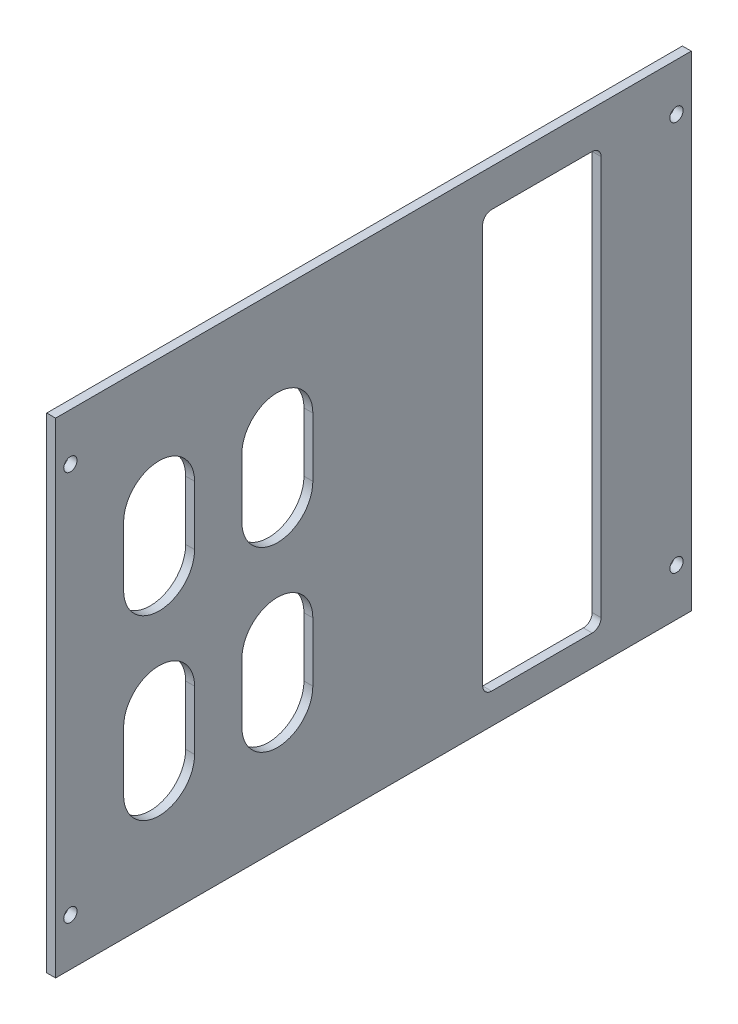
from build123d import *

# Parameters (mm, degrees)
SKETCH_1_W                         = 240
SKETCH_1_H                         = 170
EXTRUDE_1_DEPTH                    = 3
EXTRUDE_2_DEPTH                    = 10
EXTRUDE_3_DEPTH                    = 10
SKETCH_4_R                         = 3
CUT_EXTRUDE_1_DEPTH                = 6
SKETCH_5_R                         = 2.1
CUT_EXTRUDE_2_DEPTH                = 253.117036314
SKETCH_7_R                         = 1.6
SKETCH_7_W                         = 103
SKETCH_7_H                         = 20
EXTRUDE_4_DEPTH                    = 3
SKETCH_8_W                         = 110
SKETCH_8_H                         = 164
SKETCH_8_R                         = 2.1
EXTRUDE_5_DEPTH                    = 3
SKETCH_9_W                         = 240
SKETCH_9_H                         = 110
EXTRUDE_6_DEPTH                    = 3
SKETCH_10_R                        = 1.6
EXTRUDE_7_DEPTH                    = 2
SKETCH_11_W                        = 10
SKETCH_11_H                        = 20.7
SKETCH_11_R                        = 3
EXTRUDE_8_DEPTH                    = 6
CUT_EXTRUDE_3_DEPTH                = 237.788935552
SKETCH_14_R                        = 5
SKETCH_14_R_2                      = 2.25
EXTRUDE_9_DEPTH                    = 5
SKETCH_16_W                        = 20
SKETCH_16_H                        = 150
EXTRUDE_13_DEPTH                   = 3
CUT_EXTRUDE_5_DEPTH                = 282.346761133
EXTRUDE_START                      = 100
EXTRUDE_14_DEPTH                   = 10
SKETCH_21_R                        = 1.65
CUT_EXTRUDE_6_DEPTH                = 242.828451593
SKETCH_22_R                        = 3
CUT_EXTRUDE_7_DEPTH                = 240.666434863
FILLET_1_R                         = 3
FILLET_2_R                         = 3
SKETCH_4_5_R                       = 2.25
F_4_5_3MM_DEPTH                    = 3.01
SKETCH_Y_6_R                       = 3
CUT_EXTRUDE_Y_6_DEPTH              = 6.01
SKETCH_Y_3_2_R                     = 1.6
CUT_EXTRUDE_Y_3_2_DEPTH            = 3.01
A_M4_2_R                           = 2.25
A_M4_DEPTH                         = 9.01
B_M4_2_R                           = 2.25
B_M4_DEPTH                         = 9.01
MOVE_FACE_M4_4_2_4_5_BY            = 0.15
MOVE_FACE_M4_4_2_4_5_2_BY          = 0.15
MOVE_FACE_M4_4_2_4_5_3_BY          = 0.15
MOVE_FACE_M4_4_2_4_5_4_BY          = 0.15
MOVE_FACE_M4_4_2_4_5_5_BY          = 0.15
MOVE_FACE_M4_4_2_4_5_6_BY          = 0.15
MOVE_FACE_M4_4_2_4_5_7_BY          = 0.15
MOVE_FACE_M4_4_2_4_5_8_BY          = 0.15
MOVE_FACE_M4_6_4_5_BY              = 0.75
MOVE_FACE_M4_6_4_5_2_BY            = 0.75
MOVE_FACE_M4_6_4_5_3_BY            = 0.75
MOVE_FACE_M4_6_4_5_4_BY            = 0.75
MOVE_START                         = -85
MOVE_FACE_M4_3_2_4_5_OUTLINE_R     = 2.25
MOVE_FACE_M4_3_2_4_5_OUTLINE_R_2   = 1.6
MOVE_FACE_M4_3_2_4_5_DEPTH         = 3
MOVE_START_2                       = 82
MOVE_FACE_M4_3_2_4_5_2_OUTLINE_R   = 2.25
MOVE_FACE_M4_3_2_4_5_2_OUTLINE_R_2 = 1.6
MOVE_FACE_M4_3_2_4_5_2_DEPTH       = 3
MOVE_START_3                       = 47
MOVE_FACE_6_M3_3_3_OUTLINE_R       = 3
MOVE_FACE_6_M3_3_3_OUTLINE_R_2     = 1.65
MOVE_FACE_6_M3_3_3_DEPTH           = 6
MOVE_FACE_6_M3_3_3_2_OUTLINE_R     = 3
MOVE_FACE_6_M3_3_3_2_OUTLINE_R_2   = 1.65
MOVE_FACE_6_M3_3_3_2_DEPTH         = 6
MOVE_START_4                       = -82
MOVE_FACE_6_M3_3_3_3_OUTLINE_R     = 3
MOVE_FACE_6_M3_3_3_3_OUTLINE_R_2   = 1.65
MOVE_FACE_6_M3_3_3_3_DEPTH         = 6
MOVE_START_5                       = 76
MOVE_FACE_6_M3_3_3_4_OUTLINE_R     = 3
MOVE_FACE_6_M3_3_3_4_OUTLINE_R_2   = 1.65
MOVE_FACE_6_M3_3_3_4_DEPTH         = 6
Y_M3_5_9_1_5_DEPTH                 = 1.5
Y_M3_5_9_1_5_3_DEPTH               = 1.5
V3_03_A_105_START                  = 117
V3_03_A_105_OUTLINE_W              = 164
V3_03_A_105_OUTLINE_H              = 105
V3_03_A_105_OUTLINE_R              = 2.25
V3_03_A_105_DEPTH                  = 3
V3_04_B_105_START                  = -120
V3_04_B_105_OUTLINE_W              = 164
V3_04_B_105_OUTLINE_H              = 105
V3_04_B_105_OUTLINE_R              = 2.25
V3_04_B_105_DEPTH                  = 3
V3_06_B_105_START                  = 82
V3_06_B_105_OUTLINE_W              = 240
V3_06_B_105_OUTLINE_H              = 105
V3_06_B_105_OUTLINE_R              = 2.25
V3_06_B_105_DEPTH                  = 3
V3_05_A_105_START                  = -85
V3_05_A_105_OUTLINE_R              = 2.25
V3_05_A_105_DEPTH                  = 3
V3_77X53_2_W                       = 77
V3_77X53_2_H                       = 53
V3_77X53_DEPTH                     = 3.01
CUT_EXTRUDE_8_DEPTH                = 140.649561403


# Read off the part's stored shape, not the designer's step: 侧板下部四处M4_四个Ø3.2配对孔改Ø4.5通孔, 取消剩余八处铜嵌件_Ø6座改M3Ø3.3通孔, v3_03_端板A_下沿及底部孔下移105, v3_04_端板B_下沿及底部孔下移105, v3_06_侧板B_下沿及底部孔下移105, v3_05_侧板A_下沿及底部孔下移105
with BuildPart() as part:
    # 草图1 → 凸台-拉伸1 (new body)
    with BuildSketch(Plane.XY):
        Rectangle(SKETCH_1_W, SKETCH_1_H)
    extrude(amount=EXTRUDE_1_DEPTH)

    # 草图2 → 凸台-拉伸2 (add)
    with BuildSketch(Plane.XY.offset(3)):
        Polygon((117, -82), (117, -61), (111, -61), (111, -76), (96, -76), (96, -82), align=None)
        Polygon((96, 82), (117, 82), (117, 61), (111, 61), (111, 76), (96, 76), align=None)
        Polygon((-96, -82), (-117, -82), (-117, -61), (-111, -61), (-111, -76), (-96, -76), align=None)
        Polygon((-117, 82), (-117, 61), (-111, 61), (-111, 76), (-96, 76), (-96, 82), align=None)
    extrude(amount=EXTRUDE_2_DEPTH)

    # 草图3 → 凸台-拉伸3 (add)
    with BuildSketch(Plane.XY.offset(3)):
        Polygon((-22, 35), (-7, 35), (-7, 41), (-28, 41), (-43, 41), (-43, 35), (-28, 35), (-28, 20), (-22, 20), align=None)
        Polygon((117, 20), (111, 20), (111, 35), (96, 35), (96, 41), (117, 41), align=None)
        Polygon((-28, -35), (-28, -20), (-22, -20), (-22, -41), (-43, -41), (-43, -35), align=None)
        Polygon((-83, -41), (-83, -35), (-98, -35), (-98, -20), (-104, -20), (-104, -41), align=None)
        Polygon((-104, 20), (-104, 35), (-104, 41), (-98, 41), (-83, 41), (-83, 35), (-98, 35), (-98, 20), align=None)
    extrude(amount=EXTRUDE_3_DEPTH)

    # 草图4 → 切除-拉伸1 (cut)
    with BuildSketch(Plane.XZ.offset(82)):
        with Locations((101, 8)):
            Circle(SKETCH_4_R)
        with Locations((-101, 8)):
            Circle(SKETCH_4_R)
    extrude(amount=-CUT_EXTRUDE_1_DEPTH, mode=Mode.SUBTRACT)

    # 草图5 → 切除-拉伸2 (cut, through all)
    with BuildSketch(Plane.ZY.offset(117)):
        with Locations(Location((8, -66, 0), (0, 0, 270))):
            Circle(SKETCH_5_R)
        with Locations(Location((8, 66, 0), (0, 0, 270))):
            Circle(SKETCH_5_R)
    extrude(amount=-CUT_EXTRUDE_2_DEPTH, mode=Mode.SUBTRACT)

    # 底部正Y卡件_补齐两处Ø6铜螺母安装孔_固定孔位草图 → 底部正Y卡件_补齐两处Ø6铜螺母安装孔 (cut)
    with BuildSketch(Plane.XZ.offset(-76)):
        with Locations((-101, 8)):
            Circle(SKETCH_Y_6_R)
        with Locations((101, 8)):
            Circle(SKETCH_Y_6_R)
    extrude(amount=-CUT_EXTRUDE_Y_6_DEPTH, mode=Mode.SUBTRACT)

    # Move Face M4__4.2_4.5 3: a curved face moved inward by 0.15
    add(Solid.thicken(part.faces().sort_by_distance((-114, -63.9, 8))[0], -MOVE_FACE_M4_4_2_4_5_3_BY), mode=Mode.SUBTRACT)

    # Move Face M4__4.2_4.5 4: a curved face moved inward by 0.15
    add(Solid.thicken(part.faces().sort_by_distance((-114, 68.1, 8))[0], -MOVE_FACE_M4_4_2_4_5_4_BY), mode=Mode.SUBTRACT)

    # Move Face M4__4.2_4.5 5: a curved face moved inward by 0.15
    add(Solid.thicken(part.faces().sort_by_distance((114, 68.1, 8))[0], -MOVE_FACE_M4_4_2_4_5_5_BY), mode=Mode.SUBTRACT)

    # Move Face M4__4.2_4.5 6: a curved face moved inward by 0.15
    add(Solid.thicken(part.faces().sort_by_distance((114, -63.9, 8))[0], -MOVE_FACE_M4_4_2_4_5_6_BY), mode=Mode.SUBTRACT)

    # Move Face M4__6_4.5: a curved face moved outward by 0.75
    add(Solid.thicken(part.faces().sort_by_distance((-104, -79, 8))[0], MOVE_FACE_M4_6_4_5_BY))

    # Move Face M4__6_4.5 2: a curved face moved outward by 0.75
    add(Solid.thicken(part.faces().sort_by_distance((98, -79, 8))[0], MOVE_FACE_M4_6_4_5_2_BY))

    # Move Face M4__6_4.5 3: a curved face moved outward by 0.75
    add(Solid.thicken(part.faces().sort_by_distance((-104, 79, 8))[0], MOVE_FACE_M4_6_4_5_3_BY))

    # Move Face M4__6_4.5 4: a curved face moved outward by 0.75
    add(Solid.thicken(part.faces().sort_by_distance((98, 79, 8))[0], MOVE_FACE_M4_6_4_5_4_BY))


with BuildPart() as body_2:
    # 草图7 → 凸台-拉伸4 (new body)
    with BuildSketch(Plane.XZ.offset(85)):
        Polygon((-120, 3), (-83, 3), (-83, 13), (-43, 13), (-43, 3), (120, 3), (120, 113), (-120, 113), align=None)
        with Locations(Location((101, 8, 0), (0, 0, 270))):
            Circle(SKETCH_7_R, mode=Mode.SUBTRACT)
        with Locations(Location((-101, 8, 0), (0, 0, 270))):
            Circle(SKETCH_7_R, mode=Mode.SUBTRACT)
        with Locations((44.5, 23)):
            Rectangle(SKETCH_7_W, SKETCH_7_H, mode=Mode.SUBTRACT)
    extrude(amount=-EXTRUDE_4_DEPTH)


with BuildPart() as body_3:
    # 草图8 → 凸台-拉伸5 (new body)
    with BuildSketch(Plane(origin=(117, 0, 0), x_dir=(0, 0, -1), z_dir=(1, 0, 0))):
        with Locations((-58, 0)):
            Rectangle(SKETCH_8_W, SKETCH_8_H)
        with Locations(Location((-8, -66, 0), (0, 0, 90))):
            Circle(SKETCH_8_R, mode=Mode.SUBTRACT)
        with Locations(Location((-8, 66, 0), (0, 0, 90))):
            Circle(SKETCH_8_R, mode=Mode.SUBTRACT)
    extrude(amount=EXTRUDE_5_DEPTH)


with BuildPart() as body_4:
    # 镜向1: mirrored copy
    add(body_3.part.mirror(Plane(origin=(0, 0, 0), x_dir=(0, 0, 1), z_dir=(1, 0, 0))))


with BuildPart() as body_5:
    # 草图9 → 凸台-拉伸6 (new body)
    with BuildSketch(Plane(origin=(0, 82, 0), x_dir=(1, 0, 0), z_dir=(0, 1, 0))):
        with Locations((0, -58)):
            Rectangle(SKETCH_9_W, SKETCH_9_H)
    extrude(amount=EXTRUDE_6_DEPTH)


    add(body_2.part)  # 凸台-拉伸8 merges body 2
    # 草图11 → 凸台-拉伸8 (add)
    # profile 1 of 4: a face of its own
    with BuildSketch(Plane(origin=(0, 0, 53), x_dir=(-1, 0, 0), z_dir=(0, 0, -1))):
        with Locations((-112, 71.65)):
            Rectangle(SKETCH_11_W, SKETCH_11_H)
        with Locations((-112, 66.3)):
            Circle(SKETCH_11_R, mode=Mode.SUBTRACT)
    # profile 2 of 4: a face of its own
    with BuildSketch(Plane(origin=(0, 0, 53), x_dir=(-1, 0, 0), z_dir=(0, 0, -1))):
        with Locations((-112, -71.65)):
            Rectangle(SKETCH_11_W, SKETCH_11_H)
        with Locations((-112, -66.3)):
            Circle(SKETCH_11_R, mode=Mode.SUBTRACT)
    # profile 3 of 4: a face of its own
    with BuildSketch(Plane(origin=(0, 0, 53), x_dir=(-1, 0, 0), z_dir=(0, 0, -1))):
        with Locations((-26, -71.65)):
            Rectangle(SKETCH_11_W, SKETCH_11_H)
        with Locations((-26, -66.3)):
            Circle(SKETCH_11_R, mode=Mode.SUBTRACT)
    # profile 4 of 4: a face of its own
    with BuildSketch(Plane(origin=(0, 0, 53), x_dir=(-1, 0, 0), z_dir=(0, 0, -1))):
        with Locations((-26, 71.65)):
            Rectangle(SKETCH_11_W, SKETCH_11_H)
        with Locations((-26, 66.3)):
            Circle(SKETCH_11_R, mode=Mode.SUBTRACT)
    extrude(amount=EXTRUDE_8_DEPTH)

    # 草图12 → 切除-拉伸3 (cut, through all)
    with BuildSketch(Plane.XZ.offset(85)):
        with BuildLine():
            Line((109, 56), (5, 56))
            ThreePointArc((5, 56), (2.878679656, 56.878679656), (2, 59))
            Line((2, 59), (2, 73))
            ThreePointArc((2, 73), (2.878679656, 75.121320344), (5, 76))
            Line((5, 76), (109, 76))
            ThreePointArc((109, 76), (111.121320344, 75.121320344), (112, 73))
            Line((112, 73), (112, 59))
            ThreePointArc((112, 59), (111.121320344, 56.878679656), (109, 56))
        make_face()
    extrude(amount=-CUT_EXTRUDE_3_DEPTH, mode=Mode.SUBTRACT)

    # 草图14 → 凸台-拉伸9 (add)
    # profile 1 of 4: a face of its own
    with BuildSketch(Plane(origin=(0, 85, 0), x_dir=(1, 0, 0), z_dir=(0, 1, 0))):
        with Locations(Location((-109.209330844, -20.536345828, 0), (0, 0, 180))):
            Circle(SKETCH_14_R)
        with Locations(Location((-109.209330844, -20.536345828, 0), (0, 0, 180))):
            Circle(SKETCH_14_R_2, mode=Mode.SUBTRACT)
    # profile 2 of 4: a face of its own
    with BuildSketch(Plane(origin=(0, 85, 0), x_dir=(1, 0, 0), z_dir=(0, 1, 0))):
        with Locations(Location((-34.159330844, -20.536345828, 0), (0, 0, 180))):
            Circle(SKETCH_14_R)
        with Locations(Location((-34.159330844, -20.536345828, 0), (0, 0, 180))):
            Circle(SKETCH_14_R_2, mode=Mode.SUBTRACT)
    # profile 3 of 4: a face of its own
    with BuildSketch(Plane(origin=(0, 85, 0), x_dir=(1, 0, 0), z_dir=(0, 1, 0))):
        with Locations(Location((-34.159330844, -95.586345828, 0), (0, 0, 180))):
            Circle(SKETCH_14_R)
        with Locations(Location((-34.159330844, -95.586345828, 0), (0, 0, 180))):
            Circle(SKETCH_14_R_2, mode=Mode.SUBTRACT)
    # profile 4 of 4: a face of its own
    with BuildSketch(Plane(origin=(0, 85, 0), x_dir=(1, 0, 0), z_dir=(0, 1, 0))):
        with Locations(Location((-109.209330844, -95.586345828, 0), (0, 0, 180))):
            Circle(SKETCH_14_R)
        with Locations(Location((-109.209330844, -95.586345828, 0), (0, 0, 180))):
            Circle(SKETCH_14_R_2, mode=Mode.SUBTRACT)
    extrude(amount=EXTRUDE_9_DEPTH)


with BuildPart() as body_6:
    # 草图10 → 凸台-拉伸7 (new body)
    with BuildSketch(Plane.XY.offset(53)):
        Polygon((117, 82), (105.994732546, 82), (105.994732546, 66.3), (31.393483554, 66.3), (31.393483554, 82), (21, 82), (21, -82), (117, -82), align=None)
        with Locations((26, 66.3)):
            Circle(SKETCH_10_R, mode=Mode.SUBTRACT)
        with Locations((112, 66.3)):
            Circle(SKETCH_10_R, mode=Mode.SUBTRACT)
        with Locations((112, -66.3)):
            Circle(SKETCH_10_R, mode=Mode.SUBTRACT)
        with Locations((26, -66.3)):
            Circle(SKETCH_10_R, mode=Mode.SUBTRACT)
    extrude(amount=EXTRUDE_7_DEPTH)


with BuildPart() as body_6_2:
    # 草图16 → 凸台-拉伸13 (new body)
    with BuildSketch(Plane.XY.offset(113)):
        Polygon((-120, 85), (120, 85), (120, -85), (-120, -85), (-120, -15), (-112, -15), (-112, 15), (-120, 15), align=None)
        with Locations((21, 0)):
            Rectangle(SKETCH_16_W, SKETCH_16_H, mode=Mode.SUBTRACT)
    extrude(amount=EXTRUDE_13_DEPTH)

    # 草图20 → 凸台-拉伸14 (add)
    with BuildSketch(Plane.XY.offset(13).offset(EXTRUDE_START)):
        Polygon((111, 61), (111, 76), (96, 76), (96, 82), (117, 82), (117, 61), align=None)
        Polygon((-96, 82), (-117, 82), (-117, 61), (-111, 61), (-111, 76), (-96, 76), align=None)
        Polygon((-117, -61), (-117, -82), (-96, -82), (-96, -76), (-111, -76), (-111, -61), align=None)
        Polygon((111, -76), (96, -76), (96, -82), (117, -82), (117, -61), (111, -61), align=None)
    extrude(amount=-EXTRUDE_14_DEPTH)


with BuildPart() as cut_extrude_5_tool:
    # 草图18 → 切除-拉伸5 (new, through all)
    with BuildSketch(Plane(origin=(120, 0, 0), x_dir=(0, 0, -1), z_dir=(1, 0, 0))):
        with BuildLine():
            Line((-66, 40), (-66, 20))
            ThreePointArc((-66, 20), (-78, 8), (-90, 20))
            Line((-90, 20), (-90, 40))
            ThreePointArc((-90, 40), (-78, 52), (-66, 40))
        make_face()
        with BuildLine():
            Line((-66, -40), (-66, -20))
            ThreePointArc((-66, -20), (-78, -8), (-90, -20))
            Line((-90, -20), (-90, -40))
            ThreePointArc((-90, -40), (-78, -52), (-66, -40))
        make_face()
        with BuildLine():
            Line((-50, -40), (-50, -20))
            ThreePointArc((-50, -20), (-38, -8), (-26, -20))
            Line((-26, -20), (-26, -40))
            ThreePointArc((-26, -40), (-38, -52), (-50, -40))
        make_face()
        with BuildLine():
            Line((-50, 40), (-50, 20))
            ThreePointArc((-50, 20), (-38, 8), (-26, 20))
            Line((-26, 20), (-26, 40))
            ThreePointArc((-26, 40), (-38, 52), (-50, 40))
        make_face()
    extrude(amount=-CUT_EXTRUDE_5_DEPTH)


with BuildPart() as body_3_1:
    add(body_3.part)

    # 切除-拉伸5: cut by cut_extrude_5_tool
    add(cut_extrude_5_tool.part, mode=Mode.SUBTRACT)


with BuildPart() as body_4_1:
    add(body_4.part)

    # 切除-拉伸5: cut by cut_extrude_5_tool
    add(cut_extrude_5_tool.part, mode=Mode.SUBTRACT)


with BuildPart() as cut_extrude_6_tool:
    # 草图21 → 切除-拉伸6 (new, through all)
    with BuildSketch(Plane.XZ.offset(85)):
        with Locations(Location((101, 108, 0), (0, 0, 180))):
            Circle(SKETCH_21_R)
        with Locations(Location((-101, 108, 0), (0, 0, 180))):
            Circle(SKETCH_21_R)
    extrude(amount=-CUT_EXTRUDE_6_DEPTH)


with BuildPart() as body_5_1:
    add(body_5.part)

    # 切除-拉伸6: cut by cut_extrude_6_tool
    add(cut_extrude_6_tool.part, mode=Mode.SUBTRACT)

    # 圆角1
    fillet_1_edges = [body_5_1.edges().sort_by_distance(p)[0] for p in [
        (-43, -83.5, 13),
        (-83, -83.5, 13),
        (96, -83.5, 13),
        (-7, -83.5, 13),
        (-7, -83.5, 33),
        (96, -83.5, 33),
    ]]
    fillet(fillet_1_edges, radius=FILLET_1_R)

    # 四处Ø4.5通孔_孔位与孔径固定 → 四处Ø4.5盲孔_贯穿剩余3mm底壁 (cut)
    with BuildSketch(Plane.XZ.offset(-82)):
        with Locations((-109.209330844, 20.536345828)):
            Circle(SKETCH_4_5_R)
        with Locations((-34.159330844, 20.536345828)):
            Circle(SKETCH_4_5_R)
        with Locations((-34.159330844, 95.586345828)):
            Circle(SKETCH_4_5_R)
        with Locations((-109.209330844, 95.586345828)):
            Circle(SKETCH_4_5_R)
    extrude(amount=-F_4_5_3MM_DEPTH, mode=Mode.SUBTRACT)

    # 正Y侧板底部_补齐两处Ø3.2螺丝通孔_固定孔位草图 → 正Y侧板底部_补齐两处Ø3.2螺丝通孔 (cut)
    with BuildSketch(Plane.XZ.offset(-82)):
        with Locations((-101, 8)):
            Circle(SKETCH_Y_3_2_R)
        with Locations((101, 8)):
            Circle(SKETCH_Y_3_2_R)
    extrude(amount=-CUT_EXTRUDE_Y_3_2_DEPTH, mode=Mode.SUBTRACT)

    # Move Face M4__3.2_4.5 outline → Move Face M4__3.2_4.5 (cut)
    # profile 1 of 2: a face of its own
    with BuildSketch(Plane(origin=(0, 0, 0), x_dir=(1, 0, 0), z_dir=(0, 1, 0)).offset(MOVE_START)):
        with Locations((101, -8)):
            Circle(MOVE_FACE_M4_3_2_4_5_OUTLINE_R)
        with Locations((101, -8)):
            Circle(MOVE_FACE_M4_3_2_4_5_OUTLINE_R_2, mode=Mode.SUBTRACT)
    # profile 2 of 2: a face of its own
    with BuildSketch(Plane(origin=(0, 0, 0), x_dir=(1, 0, 0), z_dir=(0, 1, 0)).offset(MOVE_START)):
        with Locations((-101, -8)):
            Circle(MOVE_FACE_M4_3_2_4_5_OUTLINE_R)
        with Locations((-101, -8)):
            Circle(MOVE_FACE_M4_3_2_4_5_OUTLINE_R_2, mode=Mode.SUBTRACT)
    extrude(amount=MOVE_FACE_M4_3_2_4_5_DEPTH, mode=Mode.SUBTRACT)

    # Move Face M4__3.2_4.5 2 outline → Move Face M4__3.2_4.5 2 (cut)
    # profile 1 of 2: a face of its own
    with BuildSketch(Plane(origin=(0, 0, 0), x_dir=(1, 0, 0), z_dir=(0, 1, 0)).offset(MOVE_START_2)):
        with Locations((101, -8)):
            Circle(MOVE_FACE_M4_3_2_4_5_2_OUTLINE_R)
        with Locations((101, -8)):
            Circle(MOVE_FACE_M4_3_2_4_5_2_OUTLINE_R_2, mode=Mode.SUBTRACT)
    # profile 2 of 2: a face of its own
    with BuildSketch(Plane(origin=(0, 0, 0), x_dir=(1, 0, 0), z_dir=(0, 1, 0)).offset(MOVE_START_2)):
        with Locations((-101, -8)):
            Circle(MOVE_FACE_M4_3_2_4_5_2_OUTLINE_R)
        with Locations((-101, -8)):
            Circle(MOVE_FACE_M4_3_2_4_5_2_OUTLINE_R_2, mode=Mode.SUBTRACT)
    extrude(amount=MOVE_FACE_M4_3_2_4_5_2_DEPTH, mode=Mode.SUBTRACT)

    # Move Face 6_M3_3.3 outline → Move Face 6_M3_3.3 (add)
    # profile 1 of 2: a face of its own
    with BuildSketch(Plane.XY.offset(MOVE_START_3)):
        with Locations((112, 66.3)):
            Circle(MOVE_FACE_6_M3_3_3_OUTLINE_R)
        with Locations((112, 66.3)):
            Circle(MOVE_FACE_6_M3_3_3_OUTLINE_R_2, mode=Mode.SUBTRACT)
    # profile 2 of 2: a face of its own
    with BuildSketch(Plane.XY.offset(MOVE_START_3)):
        with Locations((26, 66.3)):
            Circle(MOVE_FACE_6_M3_3_3_OUTLINE_R)
        with Locations((26, 66.3)):
            Circle(MOVE_FACE_6_M3_3_3_OUTLINE_R_2, mode=Mode.SUBTRACT)
    extrude(amount=MOVE_FACE_6_M3_3_3_DEPTH)

    # Move Face 6_M3_3.3 2 outline → Move Face 6_M3_3.3 2 (add)
    # profile 1 of 2: a face of its own
    with BuildSketch(Plane.XY.offset(MOVE_START_3)):
        with Locations((112, -66.3)):
            Circle(MOVE_FACE_6_M3_3_3_2_OUTLINE_R)
        with Locations((112, -66.3)):
            Circle(MOVE_FACE_6_M3_3_3_2_OUTLINE_R_2, mode=Mode.SUBTRACT)
    # profile 2 of 2: a face of its own
    with BuildSketch(Plane.XY.offset(MOVE_START_3)):
        with Locations((26, -66.3)):
            Circle(MOVE_FACE_6_M3_3_3_2_OUTLINE_R)
        with Locations((26, -66.3)):
            Circle(MOVE_FACE_6_M3_3_3_2_OUTLINE_R_2, mode=Mode.SUBTRACT)
    extrude(amount=MOVE_FACE_6_M3_3_3_2_DEPTH)

    # v3_06_侧板B_下沿及底部孔下移105 outline → v3_06_侧板B_下沿及底部孔下移105 (add)
    # profile 1 of 3: a face of its own
    with BuildSketch(Plane(origin=(0, 0, 0), x_dir=(1, 0, 0), z_dir=(0, 1, 0)).offset(V3_06_B_105_START)):
        with Locations((0, 49.5)):
            Rectangle(V3_06_B_105_OUTLINE_W, V3_06_B_105_OUTLINE_H)
        with Locations((-101, 97)):
            Circle(V3_06_B_105_OUTLINE_R, mode=Mode.SUBTRACT)
        with Locations((101, 97)):
            Circle(V3_06_B_105_OUTLINE_R, mode=Mode.SUBTRACT)
    # profile 2 of 3: a face of its own
    with BuildSketch(Plane(origin=(0, 0, 0), x_dir=(1, 0, 0), z_dir=(0, 1, 0)).offset(V3_06_B_105_START)):
        with Locations((101, -8)):
            Circle(V3_06_B_105_OUTLINE_R)
    # profile 3 of 3: a face of its own
    with BuildSketch(Plane(origin=(0, 0, 0), x_dir=(1, 0, 0), z_dir=(0, 1, 0)).offset(V3_06_B_105_START)):
        with Locations((-101, -8)):
            Circle(V3_06_B_105_OUTLINE_R)
    extrude(amount=V3_06_B_105_DEPTH)

    # v3_05_侧板A_下沿及底部孔下移105 outline → v3_05_侧板A_下沿及底部孔下移105 (add)
    # profile 1 of 3: a face of its own
    with BuildSketch(Plane(origin=(0, 0, 0), x_dir=(1, 0, 0), z_dir=(0, 1, 0)).offset(V3_05_A_105_START)):
        with BuildLine():
            Line((-43, -3), (120, -3))
            Line((120, -3), (120, 102))
            Line((120, 102), (-43, 102))
            Line((-43, 102), (-43, 95))
            ThreePointArc((-43, 95), (-43.878679656, 92.878679656), (-46, 92))
            Line((-46, 92), (-80, 92))
            ThreePointArc((-80, 92), (-82.121320344, 92.878679656), (-83, 95))
            Line((-83, 95), (-83, 102))
            Line((-83, 102), (-120, 102))
            Line((-120, 102), (-120, -3))
            Line((-120, -3), (-83, -3))
            Line((-83, -3), (-83, -10))
            ThreePointArc((-83, -10), (-82.121320344, -12.121320344), (-80, -13))
            Line((-80, -13), (-46, -13))
            ThreePointArc((-46, -13), (-43.878679656, -12.121320344), (-43, -10))
            Line((-43, -10), (-43, -3))
        make_face()
        with Locations((-101, 97)):
            Circle(V3_05_A_105_OUTLINE_R, mode=Mode.SUBTRACT)
        with Locations((101, 97)):
            Circle(V3_05_A_105_OUTLINE_R, mode=Mode.SUBTRACT)
    # profile 2 of 3: a face of its own
    with BuildSketch(Plane(origin=(0, 0, 0), x_dir=(1, 0, 0), z_dir=(0, 1, 0)).offset(V3_05_A_105_START)):
        with Locations((101, -8)):
            Circle(V3_05_A_105_OUTLINE_R)
    # profile 3 of 3: a face of its own
    with BuildSketch(Plane(origin=(0, 0, 0), x_dir=(1, 0, 0), z_dir=(0, 1, 0)).offset(V3_05_A_105_START)):
        with Locations((-101, -8)):
            Circle(V3_05_A_105_OUTLINE_R)
    extrude(amount=V3_05_A_105_DEPTH)

    # v3__77x53 2 → v3__77x53 (cut)
    with BuildSketch(Plane(origin=(0, 85, 0), x_dir=(1, 0, 0), z_dir=(0, 1, 0))):
        with Locations((69, 58.5)):
            Rectangle(V3_77X53_2_W, V3_77X53_2_H)
    extrude(amount=-V3_77X53_DEPTH, mode=Mode.SUBTRACT)


with BuildPart() as body_6_2_1:
    add(body_6_2.part)

    # 切除-拉伸6: cut by cut_extrude_6_tool
    add(cut_extrude_6_tool.part, mode=Mode.SUBTRACT)

    # 草图22 → 切除-拉伸7 (cut, through all)
    with BuildSketch(Plane.XZ.offset(82)):
        with Locations((-101, 108)):
            Circle(SKETCH_22_R)
        with Locations(Location((101, 108, 0), (0, 0, 270))):
            Circle(SKETCH_22_R)
    extrude(amount=-CUT_EXTRUDE_7_DEPTH, mode=Mode.SUBTRACT)

    # 圆角2
    fillet_2_edges = [body_6_2_1.edges().sort_by_distance(p)[0] for p in [
        (-112, -15, 114.5),
        (-112, 15, 114.5),
        (31, -75, 114.5),
        (31, 75, 114.5),
        (11, 75, 114.5),
        (11, -75, 114.5),
    ]]
    fillet(fillet_2_edges, radius=FILLET_2_R)


with BuildPart() as a_m4_tool:
    # A___M4 2 → A___M4 (new body)
    with BuildSketch(Plane.ZY.offset(-111)):
        with Locations(Location((108, -66, 0), (0, 0, 270))):
            Circle(A_M4_2_R)
        with Locations(Location((108, 66, 0), (0, 0, 270))):
            Circle(A_M4_2_R)
    extrude(amount=-A_M4_DEPTH)


with BuildPart() as body_3_2:
    add(body_3_1.part)

    # A___M4: cut by a_m4_tool
    add(a_m4_tool.part, mode=Mode.SUBTRACT)

    # Move Face M4__4.2_4.5: a curved face moved inward by 0.15
    add(Solid.thicken(body_3_2.faces().sort_by_distance((118.5, -68.1, 8))[0], -MOVE_FACE_M4_4_2_4_5_BY), mode=Mode.SUBTRACT)

    # Move Face M4__4.2_4.5 2: a curved face moved inward by 0.15
    add(Solid.thicken(body_3_2.faces().sort_by_distance((118.5, 63.9, 8))[0], -MOVE_FACE_M4_4_2_4_5_2_BY), mode=Mode.SUBTRACT)

    # v3_03_端板A_下沿及底部孔下移105 outline → v3_03_端板A_下沿及底部孔下移105 (add)
    # profile 1 of 3: a face of its own
    with BuildSketch(Plane.YZ.offset(V3_03_A_105_START)):
        with Locations((0, -49.5)):
            Rectangle(V3_03_A_105_OUTLINE_W, V3_03_A_105_OUTLINE_H)
        with Locations((-66, -97)):
            Circle(V3_03_A_105_OUTLINE_R, mode=Mode.SUBTRACT)
        with Locations((66, -97)):
            Circle(V3_03_A_105_OUTLINE_R, mode=Mode.SUBTRACT)
    # profile 2 of 3: a face of its own
    with BuildSketch(Plane.YZ.offset(V3_03_A_105_START)):
        with Locations((-66, 8)):
            Circle(V3_03_A_105_OUTLINE_R)
    # profile 3 of 3: a face of its own
    with BuildSketch(Plane.YZ.offset(V3_03_A_105_START)):
        with Locations((66, 8)):
            Circle(V3_03_A_105_OUTLINE_R)
    extrude(amount=V3_03_A_105_DEPTH)

    # 草图26 → 切除-拉伸8 (cut, through all)
    with BuildSketch(Plane(origin=(120, 0, 0), x_dir=(0, 0, -1), z_dir=(1, 0, 0))):
        with BuildLine():
            Line((34.453025431, 69.349860583), (68.485469648, 69.349860583))
            ThreePointArc((68.485469648, 69.349860583), (70.606789992, 68.471180927), (71.485469648, 66.349860583))
            Line((71.485469648, 66.349860583), (71.485469648, -68.687519812))
            ThreePointArc((71.485469648, -68.687519812), (70.606789992, -70.808840156), (68.485469648, -71.687519812))
            Line((68.485469648, -71.687519812), (34.453025431, -71.687519812))
            ThreePointArc((34.453025431, -71.687519812), (32.331705088, -70.808840156), (31.453025431, -68.687519812))
            Line((31.453025431, -68.687519812), (31.453025431, 66.349860583))
            ThreePointArc((31.453025431, 66.349860583), (32.331705088, 68.471180927), (34.453025431, 69.349860583))
        make_face()
    extrude(amount=-CUT_EXTRUDE_8_DEPTH, mode=Mode.SUBTRACT)


with BuildPart() as body_6_2_2:
    add(body_6_2_1.part)

    # A___M4: cut by a_m4_tool
    add(a_m4_tool.part, mode=Mode.SUBTRACT)


with BuildPart() as b_m4_tool:
    # B___M4 2 → B___M4 (new body)
    with BuildSketch(Plane(origin=(-111, 0, 0), x_dir=(0, 0, -1), z_dir=(1, 0, 0))):
        with Locations(Location((-108, -66, 0), (0, 0, 270))):
            Circle(B_M4_2_R)
        with Locations(Location((-108, 66, 0), (0, 0, 270))):
            Circle(B_M4_2_R)
    extrude(amount=-B_M4_DEPTH)


with BuildPart() as body_4_2:
    add(body_4_1.part)

    # B___M4: cut by b_m4_tool
    add(b_m4_tool.part, mode=Mode.SUBTRACT)

    # Move Face M4__4.2_4.5 7: a curved face moved inward by 0.15
    add(Solid.thicken(body_4_2.faces().sort_by_distance((-118.5, -68.1, 8))[0], -MOVE_FACE_M4_4_2_4_5_7_BY), mode=Mode.SUBTRACT)

    # Move Face M4__4.2_4.5 8: a curved face moved inward by 0.15
    add(Solid.thicken(body_4_2.faces().sort_by_distance((-118.5, 63.9, 8))[0], -MOVE_FACE_M4_4_2_4_5_8_BY), mode=Mode.SUBTRACT)

    # v3_04_端板B_下沿及底部孔下移105 outline → v3_04_端板B_下沿及底部孔下移105 (add)
    # profile 1 of 3: a face of its own
    with BuildSketch(Plane.YZ.offset(V3_04_B_105_START)):
        with Locations((0, -49.5)):
            Rectangle(V3_04_B_105_OUTLINE_W, V3_04_B_105_OUTLINE_H)
        with Locations((-66, -97)):
            Circle(V3_04_B_105_OUTLINE_R, mode=Mode.SUBTRACT)
        with Locations((66, -97)):
            Circle(V3_04_B_105_OUTLINE_R, mode=Mode.SUBTRACT)
    # profile 2 of 3: a face of its own
    with BuildSketch(Plane.YZ.offset(V3_04_B_105_START)):
        with Locations((-66, 8)):
            Circle(V3_04_B_105_OUTLINE_R)
    # profile 3 of 3: a face of its own
    with BuildSketch(Plane.YZ.offset(V3_04_B_105_START)):
        with Locations((66, 8)):
            Circle(V3_04_B_105_OUTLINE_R)
    extrude(amount=V3_04_B_105_DEPTH)


with BuildPart() as body_6_2_3:
    add(body_6_2_2.part)

    # B___M4: cut by b_m4_tool
    add(b_m4_tool.part, mode=Mode.SUBTRACT)

    # Move Face 6_M3_3.3 3 outline → Move Face 6_M3_3.3 3 (add)
    # profile 1 of 2: a face of its own
    with BuildSketch(Plane(origin=(0, 0, 0), x_dir=(1, 0, 0), z_dir=(0, 1, 0)).offset(MOVE_START_4)):
        with Locations((101, -108)):
            Circle(MOVE_FACE_6_M3_3_3_3_OUTLINE_R)
        with Locations((101, -108)):
            Circle(MOVE_FACE_6_M3_3_3_3_OUTLINE_R_2, mode=Mode.SUBTRACT)
    # profile 2 of 2: a face of its own
    with BuildSketch(Plane(origin=(0, 0, 0), x_dir=(1, 0, 0), z_dir=(0, 1, 0)).offset(MOVE_START_4)):
        with Locations((-101, -108)):
            Circle(MOVE_FACE_6_M3_3_3_3_OUTLINE_R)
        with Locations((-101, -108)):
            Circle(MOVE_FACE_6_M3_3_3_3_OUTLINE_R_2, mode=Mode.SUBTRACT)
    extrude(amount=MOVE_FACE_6_M3_3_3_3_DEPTH)

    # Move Face 6_M3_3.3 4 outline → Move Face 6_M3_3.3 4 (add)
    # profile 1 of 2: a face of its own
    with BuildSketch(Plane(origin=(0, 0, 0), x_dir=(1, 0, 0), z_dir=(0, 1, 0)).offset(MOVE_START_5)):
        with Locations((101, -108)):
            Circle(MOVE_FACE_6_M3_3_3_4_OUTLINE_R)
        with Locations((101, -108)):
            Circle(MOVE_FACE_6_M3_3_3_4_OUTLINE_R_2, mode=Mode.SUBTRACT)
    # profile 2 of 2: a face of its own
    with BuildSketch(Plane(origin=(0, 0, 0), x_dir=(1, 0, 0), z_dir=(0, 1, 0)).offset(MOVE_START_5)):
        with Locations((-101, -108)):
            Circle(MOVE_FACE_6_M3_3_3_4_OUTLINE_R)
        with Locations((-101, -108)):
            Circle(MOVE_FACE_6_M3_3_3_4_OUTLINE_R_2, mode=Mode.SUBTRACT)
    extrude(amount=MOVE_FACE_6_M3_3_3_4_DEPTH)

    # Y__M3___5.9_1.5 2 → Y__M3___5.9_1.5 (cut)
    with BuildSketch(Plane.XZ.offset(-76)):
        Polygon((-97.593633412, 108), (-99.296816706, 110.95), (-102.703183294, 110.95), (-104.406366588, 108), (-102.703183294, 105.05), (-99.296816706, 105.05), align=None)
        Polygon((104.406366588, 108), (102.703183294, 110.95), (99.296816706, 110.95), (97.593633412, 108), (99.296816706, 105.05), (102.703183294, 105.05), align=None)
    extrude(amount=-Y_M3_5_9_1_5_DEPTH, mode=Mode.SUBTRACT)

    # Y__M3___5.9_1.5 4 → Y__M3___5.9_1.5 3 (cut)
    with BuildSketch(Plane(origin=(0, -76, 0), x_dir=(1, 0, 0), z_dir=(0, 1, 0))):
        Polygon((-97.593633412, -108), (-99.296816706, -110.95), (-102.703183294, -110.95), (-104.406366588, -108), (-102.703183294, -105.05), (-99.296816706, -105.05), align=None)
        Polygon((104.406366588, -108), (102.703183294, -110.95), (99.296816706, -110.95), (97.593633412, -108), (99.296816706, -105.05), (102.703183294, -105.05), align=None)
    extrude(amount=-Y_M3_5_9_1_5_3_DEPTH, mode=Mode.SUBTRACT)


with BuildPart() as part_1:
    # Move Body v3__105: moved
    add(part.part.moved(Location((0, 0, -105))))


solid = body_3_2.part
